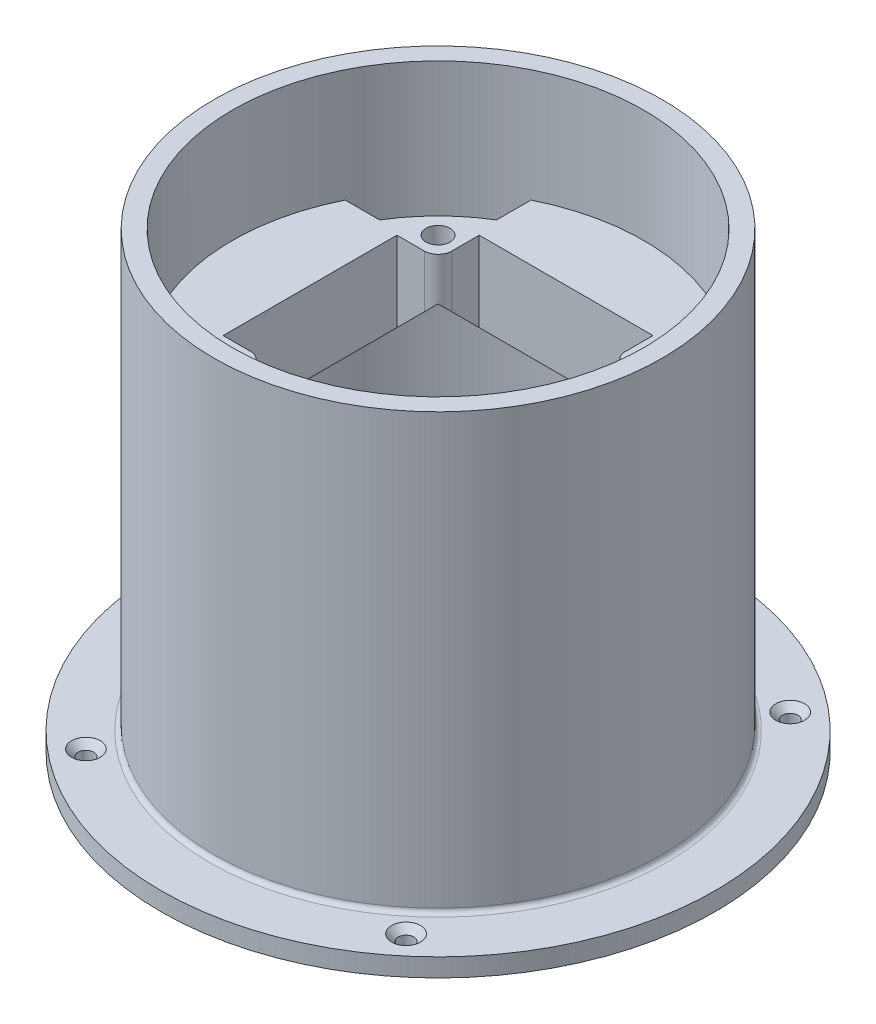
from build123d import *

# Parameters (mm, degrees)
SKETCH1_R                                           = 60.625
SKETCH1_R_2                                         = 45
BOSS_EXTRUDE4_DEPTH                                 = 4
SKETCH5_R                                           = 49
SKETCH5_R_2                                         = 45
BOSS_EXTRUDE7_DEPTH                                 = 95
CSK_FOR_M3_COUNTERSUNK_FLAT_HEAD_SCREW1_D           = 3.4
CSK_FOR_M3_COUNTERSUNK_FLAT_HEAD_SCREW1_DEPTH       = 4
CSK_FOR_M3_COUNTERSUNK_FLAT_HEAD_SCREW1_CSINK_D     = 6.3
CSK_FOR_M3_COUNTERSUNK_FLAT_HEAD_SCREW1_CSINK_ANGLE = 90
CSK_FOR_M3_COUNTERSUNK_FLAT_HEAD_SCREW1_TIP         = 1.021463052
FILLET1_R                                           = 1
BOSS_EXTRUDE8_DEPTH                                 = 20
CIRPATTERN1_COUNT                                   = 2
CIRPATTERN1_ANGLE                                   = 90
SKETCH17_R                                          = 38.4
BOSS_EXTRUDE11_DEPTH                                = 8
SKETCH17_5_R                                        = 2.625
CUT_EXTRUDE2_DEPTH                                  = 114.451625154
FILLET2_R                                           = 3
CUT_EXTRUDE3_START                                  = -80
SKETCH18_R                                          = 57.887478947
SKETCH18_R_2                                        = 49
CUT_EXTRUDE3_DEPTH                                  = 80


with BuildPart() as part:
    # Sketch1 → Boss-Extrude4 (new body)
    with BuildSketch(Plane(origin=(0, 0, 0), x_dir=(1, 0, 0), z_dir=(0, 1, 0))):
        Circle(SKETCH1_R)
        Circle(SKETCH1_R_2, mode=Mode.SUBTRACT)
    extrude(amount=BOSS_EXTRUDE4_DEPTH)

    # Sketch5 → Boss-Extrude7 (add)
    with BuildSketch(Plane(origin=(0, 4, 0), x_dir=(1, 0, 0), z_dir=(0, 1, 0))):
        Circle(SKETCH5_R)
        Circle(SKETCH5_R_2, mode=Mode.SUBTRACT)
    extrude(amount=BOSS_EXTRUDE7_DEPTH)

    # CSK for M3 Countersunk Flat Head Screw1
    with Locations(Plane(origin=(0, 4, 0), x_dir=(1, 0, 0), z_dir=(0, 1, 0))):
        with Locations((-35, 42), (35, 42), (35, -42), (-35, -42)):
            CounterSinkHole(CSK_FOR_M3_COUNTERSUNK_FLAT_HEAD_SCREW1_D / 2, CSK_FOR_M3_COUNTERSUNK_FLAT_HEAD_SCREW1_CSINK_D / 2, depth=CSK_FOR_M3_COUNTERSUNK_FLAT_HEAD_SCREW1_DEPTH, counter_sink_angle=CSK_FOR_M3_COUNTERSUNK_FLAT_HEAD_SCREW1_CSINK_ANGLE)
            with Locations((0, 0, -(CSK_FOR_M3_COUNTERSUNK_FLAT_HEAD_SCREW1_DEPTH + CSK_FOR_M3_COUNTERSUNK_FLAT_HEAD_SCREW1_TIP / 2))):  # 118° drill point
                Cone(0, CSK_FOR_M3_COUNTERSUNK_FLAT_HEAD_SCREW1_D / 2, CSK_FOR_M3_COUNTERSUNK_FLAT_HEAD_SCREW1_TIP, mode=Mode.SUBTRACT)

    # Fillet1
    fillet1_edges = [part.edges().sort_by_distance(p)[0] for p in [
        (-49, 4, 0),
    ]]
    fillet(fillet1_edges, radius=FILLET1_R)

    # Sketch8 → Boss-Extrude8 (add, symmetric)
    with BuildSketch(Plane(origin=(0, 0, 0), x_dir=(0, 0, -1), z_dir=(1, 0, 0))):
        Polygon((-47.5, 74.3), (-47.5, 66.3), (-45, 66.3), (-45, 39.8), (-18.5, 66.3), (-18.5, 74.3), align=None)
        Polygon((45, 39.8), (45, 66.3), (47.5, 66.3), (47.5, 74.3), (18.5, 74.3), (18.5, 66.3), align=None)
    boss_extrude8 = extrude(amount=BOSS_EXTRUDE8_DEPTH, both=True)

    # CirPattern1: Boss-Extrude8 ×2 about axis
    cirpattern1_axis = Axis((0, 99, 0), (0, 1, 0))
    for i in range(1, CIRPATTERN1_COUNT):
        add(boss_extrude8.rotate(cirpattern1_axis, i * CIRPATTERN1_ANGLE / (CIRPATTERN1_COUNT - 1)))

    # Sketch17 → Boss-Extrude11 (add)
    with BuildSketch(Plane(origin=(0, 74.3, 0), x_dir=(1, 0, 0), z_dir=(0, 1, 0))):
        Circle(SKETCH17_R)
        Polygon((-19, -19), (-19, -28), (19, -28), (19, -19), (28, -19), (28, 19), (19, 19), (19, 28), (-19, 28), (-19, 19), (-28, 19), (-28, -19), align=None, mode=Mode.SUBTRACT)
    extrude(amount=-BOSS_EXTRUDE11_DEPTH)

    # Sketch17<5> → Cut-Extrude2 (cut, through all)
    with BuildSketch(Plane(origin=(0, 74.3, 0), x_dir=(1, 0, 0), z_dir=(0, 1, 0))):
        with Locations((-23.5, 23.5)):
            Circle(SKETCH17_5_R)
        with Locations((23.5, 23.5)):
            Circle(SKETCH17_5_R)
        with Locations((23.5, -23.5)):
            Circle(SKETCH17_5_R)
        with Locations((-23.5, -23.5)):
            Circle(SKETCH17_5_R)
        Polygon((-19, -19), (-19, -28), (19, -28), (19, -19), (28, -19), (28, 19), (19, 19), (19, 28), (-19, 28), (-19, 19), (-28, 19), (-28, -19), align=None)
    extrude(amount=-CUT_EXTRUDE2_DEPTH, mode=Mode.SUBTRACT)

    # Fillet2
    fillet2_edges = [part.edges().sort_by_distance(p)[0] for p in [
        (19, 70.05, 19),
        (19, 70.05, -19),
        (-19, 70.05, 19),
        (-19, 70.05, -19),
    ]]
    fillet(fillet2_edges, radius=FILLET2_R)

    # Sketch18 → Cut-Extrude3 (cut)
    with BuildSketch(Plane(origin=(0, 99, 0), x_dir=(1, 0, 0), z_dir=(0, 1, 0)).offset(CUT_EXTRUDE3_START)):
        Circle(SKETCH18_R)
        Circle(SKETCH18_R_2, mode=Mode.SUBTRACT)
    extrude(amount=CUT_EXTRUDE3_DEPTH, mode=Mode.SUBTRACT)


solid = part.part
